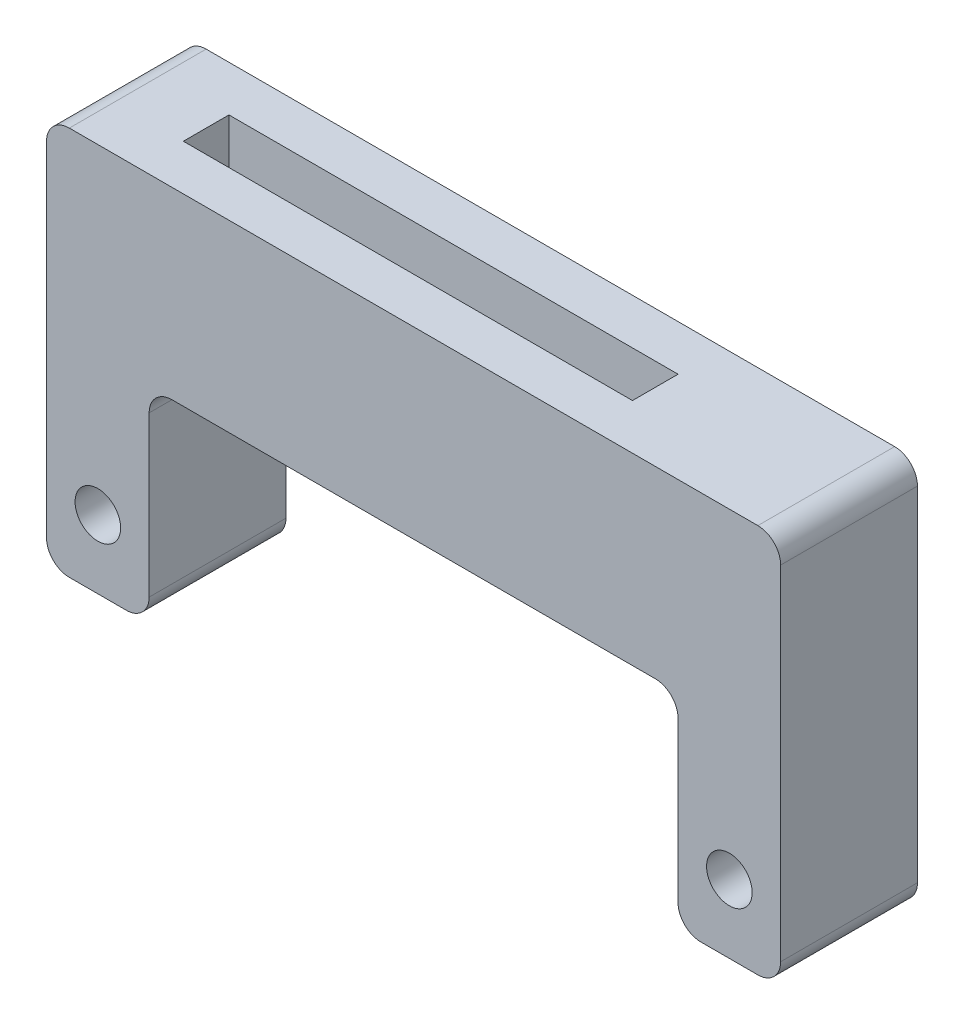
from build123d import *

# Parameters (mm, degrees)
SKETCH2_W           = 32.2
SKETCH2_H           = 17.068
BOSS_EXTRUDE1_DEPTH = 3
SKETCH3_W           = 19.7
SKETCH3_H           = 2
CUT_EXTRUDE1_DEPTH  = 2.5
SKETCH4_W           = 23.2
SKETCH4_H           = 9
CUT_EXTRUDE2_DEPTH  = 20.18434664
SKETCH5_R           = 1
CUT_EXTRUDE3_DEPTH  = 20.18434664
FILLET1_R           = 1
SCALE1_SCALE        = 1.02


with BuildPart() as part:
    # Sketch2 → Boss-Extrude1 (new, symmetric)
    with BuildSketch(Plane.XY):
        Rectangle(SKETCH2_W, SKETCH2_H)
    extrude(amount=BOSS_EXTRUDE1_DEPTH, both=True)

    # Sketch3 → Cut-Extrude1 (cut)
    with BuildSketch(Plane(origin=(0, 8.534, 0), x_dir=(1, 0, 0), z_dir=(0, 1, 0))):
        with Locations((-2.25, 0)):
            Rectangle(SKETCH3_W, SKETCH3_H)
    extrude(amount=-CUT_EXTRUDE1_DEPTH, mode=Mode.SUBTRACT)

    # Sketch4 → Cut-Extrude2 (cut, through all)
    with BuildSketch(Plane.XY.offset(3)):
        with Locations((0, -4.034)):
            Rectangle(SKETCH4_W, SKETCH4_H)
    extrude(amount=-CUT_EXTRUDE2_DEPTH, mode=Mode.SUBTRACT)

    # Sketch5 → Cut-Extrude3 (cut, through all)
    with BuildSketch(Plane.XY.offset(3)):
        with Locations((-13.85, -5.534)):
            Circle(SKETCH5_R)
        with Locations((13.85, -5.534)):
            Circle(SKETCH5_R)
    extrude(amount=-CUT_EXTRUDE3_DEPTH, mode=Mode.SUBTRACT)

    # Fillet1
    fillet1_edges = [part.edges().sort_by_distance(p)[0] for p in [
        (16.1, 8.534, 0),
        (16.1, -8.534, 0),
        (11.6, -8.534, 0),
        (11.6, 0.466, 0),
        (-11.6, 0.466, 0),
        (-11.6, -8.534, 0),
        (-16.1, -8.534, 0),
        (-16.1, 8.534, 0),
    ]]
    fillet(fillet1_edges, radius=FILLET1_R)


with BuildPart() as part_1:
    # Scale1: scaled about (0.116437108, 2.399392312, 0)
    add(part.part.scale(SCALE1_SCALE).moved(Location((-0.002328742, -0.047987846, 0))))


solid = part_1.part
